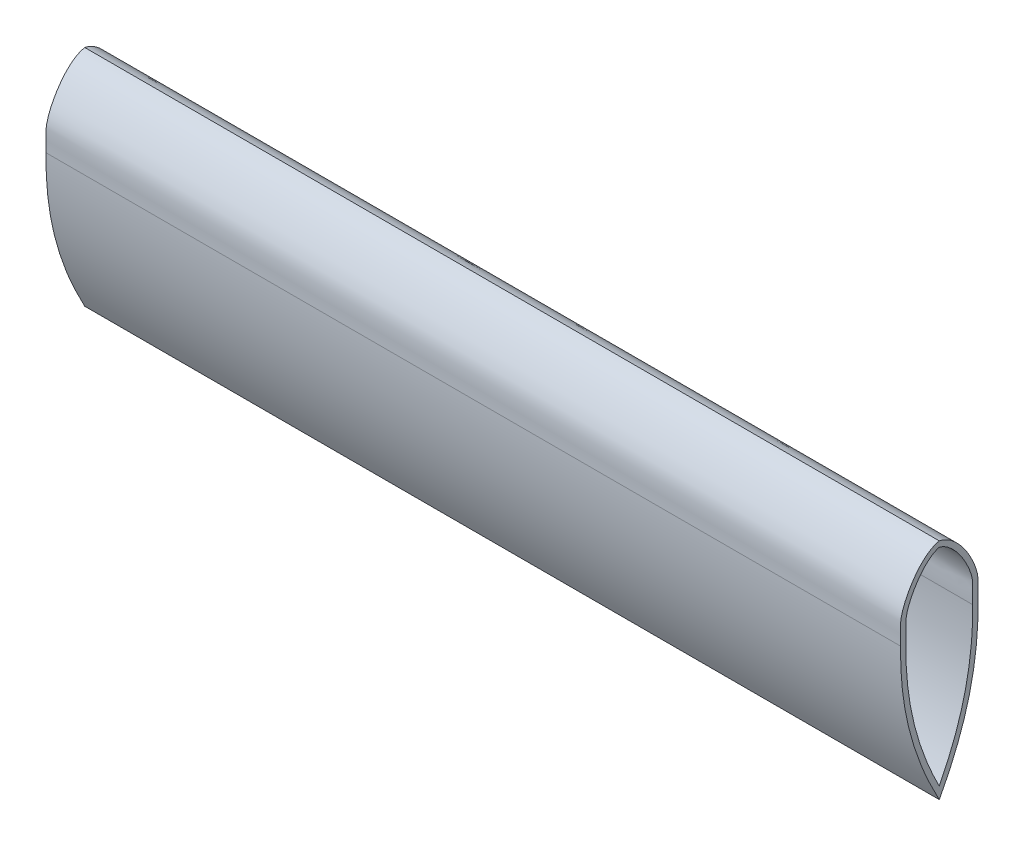
from build123d import *

# Parameters (mm, degrees)
BOSS_EXTRUDE1_DEPTH      = 153.61996
BOSS_EXTRUDE1_DEPTH_BACK = 104.21574
SKETCH1_R                = 7.9375
SKETCH1_R_2              = 6.4643
EXTRUDE_THIN1_START      = -203.2
EXTRUDE_THIN1_DEPTH      = 203.2


# Read off the part's stored shape, not the designer's step: Extrude-Thin1
with BuildPart() as part:
    # Sketch1 → Boss-Extrude1 (new, two sides: drawn at the far end of the back side and taken through both)
    with BuildSketch(Plane(origin=(0, 0, 0), x_dir=(0, 0, -1), z_dir=(1, 0, 0)).offset(-BOSS_EXTRUDE1_DEPTH_BACK)):
        with Locations(Location((0, 0, 0), (0, 0, 270))):
            Circle(SKETCH1_R)
        with Locations(Location((0, 0, 0), (0, 0, 270))):
            Circle(SKETCH1_R_2, mode=Mode.SUBTRACT)
    extrude(amount=BOSS_EXTRUDE1_DEPTH + BOSS_EXTRUDE1_DEPTH_BACK)


with BuildPart() as body_2:
    # Extrude-Thin1 outline → Extrude-Thin1 (new body)
    with BuildSketch(Plane(origin=(153.619959862, 0, 0), x_dir=(0, 0, -1), z_dir=(1, 0, 0)).offset(EXTRUDE_THIN1_START)):
        with BuildLine():
            add(Edge.make_bspline(
                [(0, 17.207559546), (-0.213797016, 17.152862004), (-0.42880706, 17.100801803), (-0.845636753, 16.968003101), (-1.049002351, 16.890625775), (-1.646041309, 16.630103699), (-2.026757553, 16.418787844), (-2.577500677, 16.057610271), (-2.758298236, 15.929264249), (-3.108894312, 15.662943804), (-3.279121061, 15.524761589), (-3.776732023, 15.097272706), (-4.091162254, 14.795137978), (-4.692872976, 14.163982702), (-4.980096404, 13.834905644), (-5.531572182, 13.154003751), (-5.79630298, 12.801295822), (-6.549823619, 11.726851467), (-7.002537116, 10.985157901), (-7.81841744, 9.455950062), (-8.182458905, 8.668883339), (-8.640371405, 7.443177376), (-8.778488758, 7.025596822), (-9.009083778, 6.173827929), (-9.100109427, 5.746682632), (-9.20377314, 4.888320037), (-9.211792234, 4.456862798), (-9.198956322, 3.592448397), (-9.189105956, 3.160062893), (-9.172251023, 1.863565908), (-9.176084553, 1.000017435), (-9.207156149, 0.137883897)],
                knots=[0, 0, 0, 0, 0.03125, 0.03125, 0.0625, 0.0625, 0.125, 0.125, 0.15625, 0.15625, 0.1875, 0.1875, 0.25, 0.25, 0.3125, 0.3125, 0.375, 0.375, 0.5, 0.5, 0.625, 0.625, 0.6875, 0.6875, 0.75, 0.75, 0.8125, 0.8125, 0.875, 0.875, 1, 1, 1, 1], degree=3))
            add(Edge.make_bspline(
                [(-9.207156149, 0.137883897), (-9.254567879, -3.016061968), (-9.110594057, -6.162643619), (-8.569736414, -10.862643519), (-8.336275013, -12.419752076), (-7.761375356, -15.514560805), (-7.419573925, -17.053624435), (-6.234254823, -21.632621497), (-5.234488958, -24.618892113), (-3.451071682, -29.000286622), (-2.811540258, -30.439512737), (-1.79028171, -32.569146175), (-1.438672145, -33.273749518), (-0.719336072, -34.675359425), (-0.359668036, -35.376164378), (0, -36.076969332)],
                knots=[0, 0, 0, 0, 0.25, 0.25, 0.375, 0.375, 0.5, 0.5, 0.75, 0.75, 0.875, 0.875, 0.9375, 0.9375, 1, 1, 1, 1], degree=3))
            add(Edge.make_bspline(
                [(0, -36.076969332), (0.359723472, -35.376056363), (0.719446944, -34.675143394), (1.438893888, -33.273317456), (1.790565857, -32.568572444), (2.812063227, -30.438384557), (3.452048995, -28.998025839), (4.640936279, -26.076956924), (5.18815569, -24.600410118), (6.182841679, -21.613493253), (6.630656344, -20.101718647), (7.815624895, -15.522775449), (8.389928975, -12.426265441), (9.11075463, -6.160134365), (9.254567065, -3.016007792), (9.207156149, 0.137883897)],
                knots=[0, 0, 0, 0, 0.0625, 0.0625, 0.125, 0.125, 0.25, 0.25, 0.375, 0.375, 0.5, 0.5, 0.75, 0.75, 1, 1, 1, 1], degree=3))
            add(Edge.make_bspline(
                [(9.207156149, 0.137883897), (9.175689476, 1.0109795), (9.172233827, 1.884590619), (9.189718729, 3.195424485), (9.200223759, 3.632455178), (9.211783508, 4.50634264), (9.200702397, 4.942976061), (9.116060671, 5.596674351), (9.077545633, 5.814621094), (8.98673913, 6.242698466), (8.934293247, 6.453967929), (8.760718275, 7.081391667), (8.623619453, 7.491266508), (8.167045839, 8.703087673), (7.803203601, 9.487588343), (7.187490205, 10.636834402), (6.969553739, 11.016052248), (6.513571235, 11.757163338), (6.275223658, 12.119743306), (5.527228859, 13.18210628), (4.98589787, 13.857489095), (4.084483233, 14.801700924), (3.767120438, 15.10608301), (3.105568901, 15.673289405), (2.760825125, 15.937099293), (2.216615083, 16.294420145), (2.030666021, 16.407085609), (1.648130786, 16.617343262), (1.450611941, 16.715328905), (1.048088593, 16.891075907), (0.843382437, 16.968818509), (0.426225712, 17.101525866), (0.212641899, 17.153157527), (0, 17.207559546)],
                knots=[0, 0, 0, 0, 0.125, 0.125, 0.1875, 0.1875, 0.25, 0.25, 0.28125, 0.28125, 0.3125, 0.3125, 0.375, 0.375, 0.5, 0.5, 0.5625, 0.5625, 0.625, 0.625, 0.75, 0.75, 0.8125, 0.8125, 0.875, 0.875, 0.90625, 0.90625, 0.9375, 0.9375, 0.96875, 0.96875, 1, 1, 1, 1], degree=3))
        make_face()
        with BuildLine():
            add(Edge.make_bspline(
                [(-7.9375, 0.105464983), (-8.117600633, -11.875275839), (-5.466290217, -22.644593383), (0, -33.295535017)],
                knots=[0, 0, 0, 0, 1, 1, 1, 1], degree=3))
            add(Edge.make_bspline(
                [(0, 15.896655346), (-3.804147623, 14.923407312), (-7.989029069, 7.547083002), (-7.925930538, 3.33473819), (-7.884513847, 1.575654615), (-7.9375, 0.105464983)],
                knots=[0, 0, 0, 0, 0.663308265, 0.763308265, 1, 1, 1, 1], degree=3))
            add(Edge.make_bspline(
                [(7.9375, 0.105464983), (7.884513847, 1.575654615), (7.925930538, 3.33473819), (7.989029069, 7.547083002), (3.804147623, 14.923407312), (0, 15.896655346)],
                knots=[0, 0, 0, 0, 0.236691735, 0.336691735, 1, 1, 1, 1], degree=3))
            add(Edge.make_bspline(
                [(0, -33.295535017), (5.466290217, -22.644593383), (8.117600633, -11.875275839), (7.9375, 0.105464983)],
                knots=[0, 0, 0, 0, 1, 1, 1, 1], degree=3))
        make_face(mode=Mode.SUBTRACT)
    extrude(amount=EXTRUDE_THIN1_DEPTH)


solid = body_2.part
